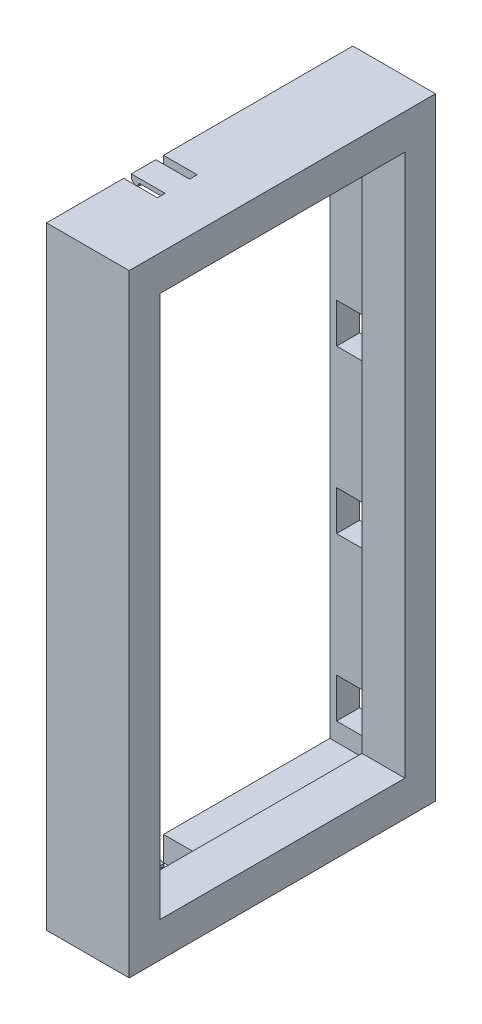
from build123d import *

# Parameters (mm, degrees)
SKETCH1_W           = 200
SKETCH1_H           = 100
SKETCH1_W_2         = 177
SKETCH1_H_2         = 80
BOSS_EXTRUDE1_DEPTH = 14
SKETCH2_W           = 200
SKETCH2_H           = 100
SKETCH2_W_2         = 184
SKETCH2_H_2         = 85
BOSS_EXTRUDE2_DEPTH = 13
SKETCH4_W           = 10.8
SKETCH4_H           = 13
CUT_EXTRUDE2_DEPTH  = 137.938854968
SKETCH5_W           = 8
SKETCH5_H           = 13
SKETCH5_H_2         = 21
CUT_EXTRUDE3_DEPTH  = 11
SKETCH7_W           = 1.4
SKETCH7_H           = 8
BOSS_EXTRUDE3_DEPTH = 11
SKETCH8_W           = 2.6
SKETCH8_H           = 8
BOSS_EXTRUDE4_DEPTH = 2
CHAMFER3_SIZE       = 2
CHAMFER4_SIZE       = 1.154700538
CHAMFER4_SIZE_2     = 2
MIRROR2_START       = 14.3
MIRROR2_DEPTH       = 8


# Read off the part's stored shape, not the designer's step: Mirror2
with BuildPart() as part:
    # Sketch1 → Boss-Extrude1 (new body)
    with BuildSketch(Plane.YZ):
        Rectangle(SKETCH1_W, SKETCH1_H)
        Rectangle(SKETCH1_W_2, SKETCH1_H_2, mode=Mode.SUBTRACT)
    extrude(amount=BOSS_EXTRUDE1_DEPTH)

    # Sketch2 → Boss-Extrude2 (add)
    with BuildSketch(Plane(origin=(0, 0, 0), x_dir=(0, -1, 0), z_dir=(-1, 0, 0))):
        Rectangle(SKETCH2_W, SKETCH2_H)
        Rectangle(SKETCH2_W_2, SKETCH2_H_2, mode=Mode.SUBTRACT)
    extrude(amount=BOSS_EXTRUDE2_DEPTH)

    # Sketch4 → Cut-Extrude2 (cut, through all)
    with BuildSketch(Plane.XY.offset(-42.5)):
        with Locations((-5.4, 79.5)):
            Rectangle(SKETCH4_W, SKETCH4_H)
        with Locations((-5.4, 26.5)):
            Rectangle(SKETCH4_W, SKETCH4_H)
        with Locations((-5.4, -26.5)):
            Rectangle(SKETCH4_W, SKETCH4_H)
        with Locations((-5.4, -79.5)):
            Rectangle(SKETCH4_W, SKETCH4_H)
    extrude(amount=-CUT_EXTRUDE2_DEPTH, mode=Mode.SUBTRACT)

    # Sketch5 → Cut-Extrude3 (cut)
    with BuildSketch(Plane(origin=(-13, 0, 0), x_dir=(0, -1, 0), z_dir=(-1, 0, 0))):
        with Locations((-96, 18.3)):
            Rectangle(SKETCH5_W, SKETCH5_H)
        with Locations((96, 22.3)):
            Rectangle(SKETCH5_W, SKETCH5_H_2)
    extrude(amount=-CUT_EXTRUDE3_DEPTH, mode=Mode.SUBTRACT)

    # Sketch7 → Boss-Extrude3 (add)
    with BuildSketch(Plane(origin=(-2, 0, 0), x_dir=(0, -1, 0), z_dir=(-1, 0, 0))):
        with Locations((-99.3, 18.3)):
            Rectangle(SKETCH7_W, SKETCH7_H)
        with Locations((99.3, 18.3)):
            Rectangle(SKETCH7_W, SKETCH7_H)
    extrude(amount=BOSS_EXTRUDE3_DEPTH)

    # Sketch8 → Boss-Extrude4 (add)
    with BuildSketch(Plane.XZ.offset(-98.6)):
        with Locations((-11.7, 18.3)):
            Rectangle(SKETCH8_W, SKETCH8_H)
    extrude(amount=BOSS_EXTRUDE4_DEPTH)

    # Chamfer3
    chamfer3_edges = [part.edges().sort_by_distance(p)[0] for p in [
        (-13, 96.6, 18.3),
    ]]
    chamfer(chamfer3_edges, length=CHAMFER3_SIZE)

    # Chamfer4
    # the kernel refuses this chamfer: 2, 1.154700538 mm, written as the material it takes off along each edge
    with BuildSketch(Plane(origin=(-10.4, 96.6, 27.474171509), x_dir=(-0.9983227437537927, -0.057893862402668146, 0), z_dir=(0, 0, -1))) as chamfer4_piece_1_section:
        Polygon((CHAMFER4_SIZE * 0.998322744082, CHAMFER4_SIZE * 0.0578938624217), (-CHAMFER4_SIZE_2 * 0.0578938624027, CHAMFER4_SIZE_2 * 0.998322743754), (0, 0), align=None)
    chamfer4_piece_1 = extrude(amount=18.348343019, mode=Mode.PRIVATE)
    chamfer4_piece_1 = split(chamfer4_piece_1, bisect_by=Plane(origin=(-10.737181007, 97.317358716, 24.8), z_dir=(0, 0, -1)), keep=Keep.TOP, mode=Mode.PRIVATE)
    chamfer4_piece_1 = split(chamfer4_piece_1, bisect_by=Plane(origin=(-10.737181007, 97.317358716, 11.8), z_dir=(0, 0, 1)), keep=Keep.TOP, mode=Mode.PRIVATE)
    add(chamfer4_piece_1, mode=Mode.SUBTRACT)

    # Mirror2 outline → Mirror2 (add)
    with BuildSketch(Plane.XY.offset(MIRROR2_START)):
        Polygon((-13, -98.6), (-10.4, -98.6), (-10.4, -97.754700538), (-11.512435565, -97.112435565), align=None)
    extrude(amount=MIRROR2_DEPTH)


solid = part.part
